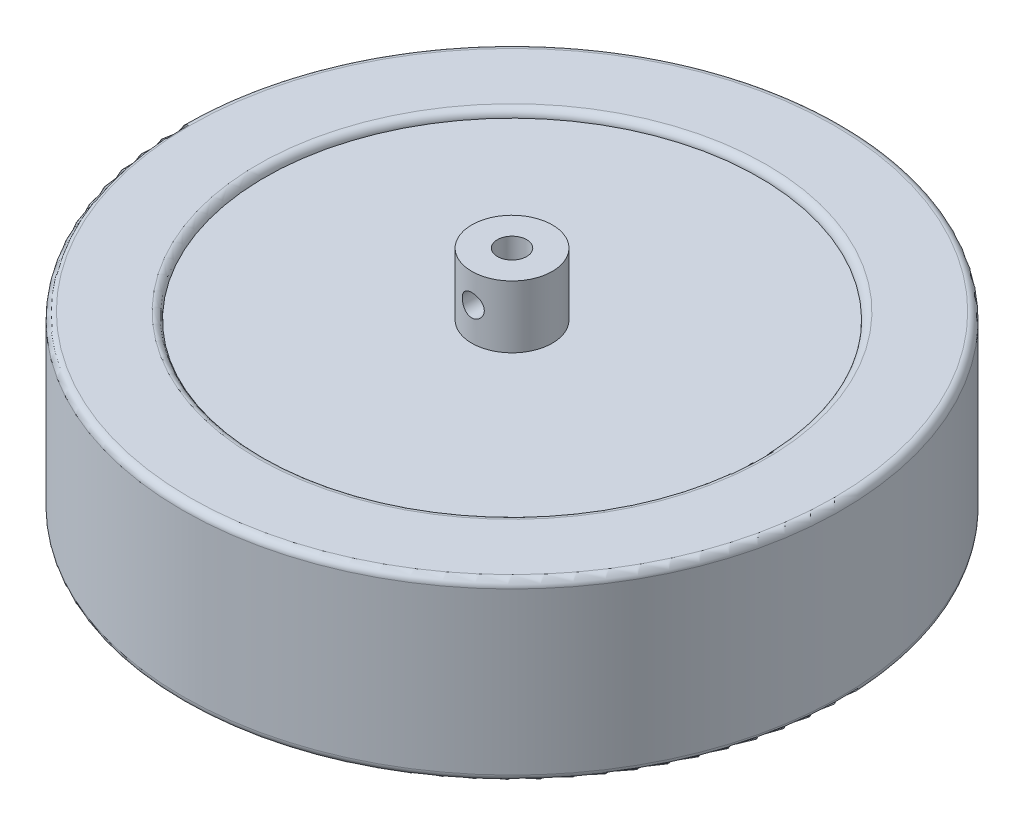
from build123d import *

# Parameters (mm, degrees)
SKETCH2_R           = 90
BOSS_EXTRUDE1_DEPTH = 48
SKETCH3_R           = 67.5
CUT_EXTRUDE1_DEPTH  = 2
CUT_EXTRUDE2_START  = -2
SKETCH4_R           = 67.5
CUT_EXTRUDE2_DEPTH  = 2
FILLET1_R           = 2
SKETCH_1_R          = 11
EXTRUDE_1_DEPTH     = 17
SKETCH_2_R          = 4
CUT_EXTRUDE_1_DEPTH = 15
SKETCH_3_R          = 3
CUT_EXTRUDE_2_DEPTH = 15


with BuildPart() as part:
    # Sketch2 → Boss-Extrude1 (new body)
    with BuildSketch(Plane(origin=(0, 0, 0), x_dir=(1, 0, 0), z_dir=(0, 1, 0))):
        with Locations(Location((0, 0, 0), (0, 0, 270))):
            Circle(SKETCH2_R)
    extrude(amount=BOSS_EXTRUDE1_DEPTH)

    # Sketch3 → Cut-Extrude1 (cut)
    with BuildSketch(Plane(origin=(0, 48, 0), x_dir=(1, 0, 0), z_dir=(0, 1, 0))):
        with Locations(Location((0, 0, 0), (0, 0, 270))):
            Circle(SKETCH3_R)
    extrude(amount=-CUT_EXTRUDE1_DEPTH, mode=Mode.SUBTRACT)

    # Sketch4 → Cut-Extrude2 (cut)
    with BuildSketch(Plane.XZ.offset(CUT_EXTRUDE2_START)):
        with Locations(Location((0, 0, 0), (0, 0, 90))):
            Circle(SKETCH4_R)
    extrude(amount=CUT_EXTRUDE2_DEPTH, mode=Mode.SUBTRACT)

    # Fillet1
    fillet1_edges = [part.edges().sort_by_distance(p)[0] for p in [
        (0, 0, -67.5),
        (0, 0, -90),
        (0, 48, -90),
        (0, 48, -67.5),
    ]]
    fillet(fillet1_edges, radius=FILLET1_R - 0.0001)  # a hair under: the kernel refuses the full size

    # 草图1 → 凸台-拉伸1 (add)
    with BuildSketch(Plane(origin=(0, 46, 0), x_dir=(1, 0, 0), z_dir=(0, 1, 0))):
        with Locations(Location((0, 0, 0), (0, 0, 270))):
            Circle(SKETCH_1_R)
    extrude(amount=EXTRUDE_1_DEPTH)

    # 草图2 → 切除-拉伸1 (cut)
    with BuildSketch(Plane(origin=(0, 63, 0), x_dir=(1, 0, 0), z_dir=(0, 1, 0))):
        with Locations(Location((0, 0, 0), (0, 0, 270))):
            Circle(SKETCH_2_R)
    extrude(amount=-CUT_EXTRUDE_1_DEPTH, mode=Mode.SUBTRACT)

    # 草图3 → 切除-拉伸2 (cut)
    with BuildSketch(Plane.XY):
        with Locations(Location((0, 55, 0), (0, 0, 90.000000006))):
            Circle(SKETCH_3_R)
    extrude(amount=CUT_EXTRUDE_2_DEPTH, mode=Mode.SUBTRACT)


solid = part.part
